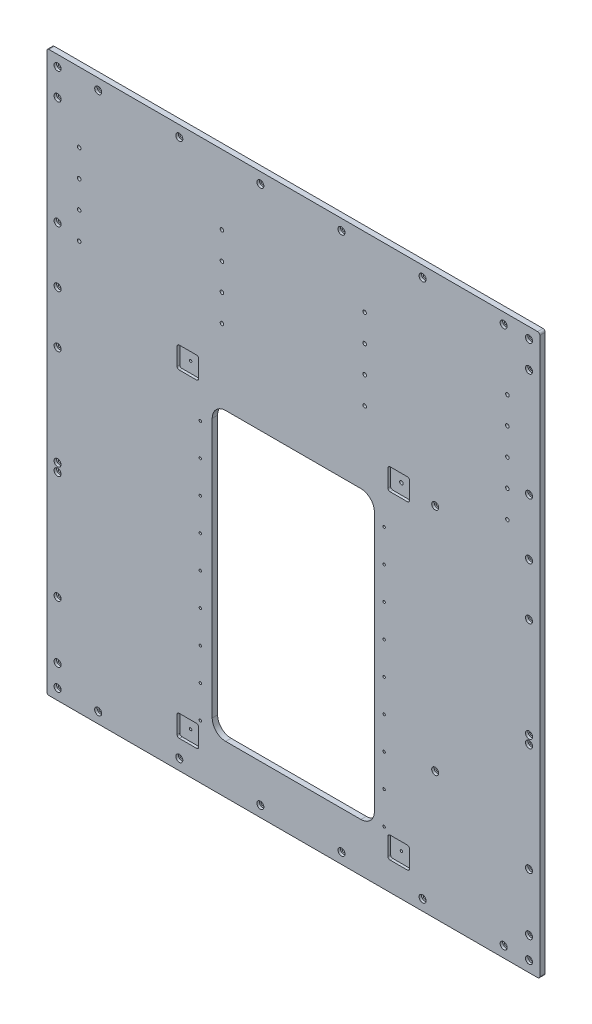
from build123d import *

# Parameters (mm, degrees)
BOSS_EXTRU_1_DEPTH                           = 10
ENL_V_MAT_EXTRU_1_DEPTH                      = 690.813199352
D_GAGEMENT_M41_D                             = 4.5
R_P_TITION_LIN_AIRE8_COUNT                   = 9
R_P_TITION_LIN_AIRE8_PITCH                   = 60
R_P_TITION_LIN_AIRE8_COUNT_DIR2              = 2
R_P_TITION_LIN_AIRE8_PITCH_DIR2              = 340
D_GAGEMENT_M65_D                             = 6.6
R_P_TITION_LIN_AIRE9_COUNT                   = 2
R_P_TITION_LIN_AIRE9_PITCH                   = 872
R_P_TITION_LIN_AIRE10_COUNT                  = 6
R_P_TITION_LIN_AIRE10_PITCH                  = 150
R_P_TITION_LIN_AIRE11_COUNT                  = 5
R_P_TITION_LIN_AIRE11_PITCH                  = 200
R_P_TITION_LIN_AIRE11_COUNT_DIR2             = 2
R_P_TITION_LIN_AIRE11_PITCH_DIR2             = 872
CHAMBRAGE_POUR_VIS_T_TE_RONDE_BOMB_4_A_COUNT = 2
CHAMBRAGE_POUR_VIS_T_TE_RONDE_BOMB_4_A_PITCH = 40
R_P_TITION_LIN_AIRE13_COUNT                  = 2
R_P_TITION_LIN_AIRE13_PITCH                  = 872
R_P_TITION_LIN_AIRE14_COUNT                  = 6
R_P_TITION_LIN_AIRE14_PITCH                  = 150
ESQUISSE41_R                                 = 1.5
ENL_V_MAT_EXTRU_2_DEPTH                      = 690.813199352
CHAMBRAGE_POUR_VIS_T_TE_RONDE_BOMB_6_A_COUNT = 2
CHAMBRAGE_POUR_VIS_T_TE_RONDE_BOMB_6_A_PITCH = 281
CHAMBRAGE_POUR_VIS_T_TE_RONDE_BOMB_7_COUNT   = 2
CHAMBRAGE_POUR_VIS_T_TE_RONDE_BOMB_7_PITCH   = 916.15773751
CHAMBRAGE_POUR_VIS_T_TE_RONDE_BOMB_8_COUNT   = 2
CHAMBRAGE_POUR_VIS_T_TE_RONDE_BOMB_8_PITCH   = 872
D_GAGEMENT_M67_D                             = 6.6
R_P_TITION_LIN_AIRE15_COUNT                  = 4
R_P_TITION_LIN_AIRE15_PITCH                  = 264
R_P_TITION_LIN_AIRE15_COUNT_DIR2             = 5
R_P_TITION_LIN_AIRE15_PITCH_DIR2             = 50
D_GAGEMENT_M68_D                             = 6.6
R_P_TITION_LIN_AIRE16_COUNT                  = 2
R_P_TITION_LIN_AIRE16_PITCH                  = 390
R_P_TITION_LIN_AIRE16_COUNT_DIR2             = 2
R_P_TITION_LIN_AIRE16_PITCH_DIR2             = 590
ENL_V_MAT_EXTRU_6_DEPTH                      = 5
R_P_TITION_LIN_AIRE18_COUNT                  = 2
R_P_TITION_LIN_AIRE18_PITCH                  = 590
R_P_TITION_LIN_AIRE18_COUNT_DIR2             = 2
R_P_TITION_LIN_AIRE18_PITCH_DIR2             = 390
ENL_V_MAT_EXTRU_9_DEPTH                      = 5
R_P_TITION_LIN_AIRE20_COUNT                  = 2
R_P_TITION_LIN_AIRE20_PITCH                  = 425
D_GAGEMENT_M610_D                            = 6.6
R_P_TITION_LIN_AIRE21_COUNT                  = 2
R_P_TITION_LIN_AIRE21_PITCH                  = 425


with BuildPart() as part:
    # Esquisse1 → Boss.-Extru.1 (new body)
    with BuildSketch(Plane.XY):
        with BuildLine():
            Line((-452, -517.5), (452, -517.5))
            ThreePointArc((452, -517.5), (454.828427125, -516.328427125), (456, -513.5))
            Line((456, -513.5), (456, 513.5))
            ThreePointArc((456, 513.5), (454.828427125, 516.328427125), (452, 517.5))
            Line((452, 517.5), (-452, 517.5))
            ThreePointArc((-452, 517.5), (-454.828427125, 516.328427125), (-456, 513.5))
            Line((-456, 513.5), (-456, -513.5))
            ThreePointArc((-456, -513.5), (-454.828427125, -516.328427125), (-452, -517.5))
        make_face()
    extrude(amount=BOSS_EXTRU_1_DEPTH)

    # Esquisse2 → Enlèv. mat.-Extru.1 (cut, through all)
    with BuildSketch(Plane.XY.offset(10)):
        with BuildLine():
            Line((-125, -427.5), (125, -427.5))
            ThreePointArc((125, -427.5), (142.67766953, -420.17766953), (150, -402.5))
            Line((150, -402.5), (150, 77.5))
            ThreePointArc((150, 77.5), (142.67766953, 95.17766953), (125, 102.5))
            Line((125, 102.5), (-125, 102.5))
            ThreePointArc((-125, 102.5), (-142.67766953, 95.17766953), (-150, 77.5))
            Line((-150, 77.5), (-150, -402.5))
            ThreePointArc((-150, -402.5), (-142.67766953, -420.17766953), (-125, -427.5))
        make_face()
    extrude(amount=-ENL_V_MAT_EXTRU_1_DEPTH, mode=Mode.SUBTRACT)

    # Dégagement M41 (through all)
    with Locations(Plane.XY.offset(10)):
        with Locations((-172, -417.5)):
            d_gagement_m41 = Hole(D_GAGEMENT_M41_D / 2)

    # Répétition linéaire8: D_gagement M41 9 × 2
    with Locations(*[(j * R_P_TITION_LIN_AIRE8_PITCH_DIR2, i * R_P_TITION_LIN_AIRE8_PITCH, 0) for i in range(R_P_TITION_LIN_AIRE8_COUNT) for j in range(R_P_TITION_LIN_AIRE8_COUNT_DIR2) if (i, j) != (0, 0)]):
        add(d_gagement_m41, mode=Mode.SUBTRACT)

    # Dégagement M65 (through all)
    with Locations(Plane(origin=(0, 0, 0), x_dir=(-1, 0, 0), z_dir=(0, 0, -1))):
        with Locations((-436.000000001, 497.5), (-436.000000001, 448.286376646), (-389.123182304, 497.5), (-436.000000001, -457.5), (-436.000000001, -497.5), (-389.123182304, -497.5), (435.999999999, -457.5), (435.999999999, -497.5)):
            Hole(D_GAGEMENT_M65_D / 2)

    # Esquisse27 → Chambrage pour vis _ t_te ronde bomb_e M (revolve, cut)
    with BuildSketch(Plane(origin=(436.000000001, 497.5, 10), x_dir=(0, -1, 0), z_dir=(1, 0, 0))):
        Polygon((0, 0), (0, 10), (3.3, 10), (3.3, 4.625), (3.325, 4.6), (6.5, 4.6), (6.5, 0), align=None)
    chambrage_pour_vis_t_te_ronde_bomb_e_m = revolve(axis=Axis((436.000000001, 497.5, 16.35), (0, 0, -1)), mode=Mode.SUBTRACT)

    # Répétition linéaire9: Chambrage pour vis _ t_te ronde bomb_e M ×2
    with Locations(*[(-i * R_P_TITION_LIN_AIRE9_PITCH, 0, 0) for i in range(1, R_P_TITION_LIN_AIRE9_COUNT)]):
        add(chambrage_pour_vis_t_te_ronde_bomb_e_m, mode=Mode.SUBTRACT)

    # Esquisse29 → Chambrage pour vis _ t_te ronde bomb 2 (revolve, cut)
    with BuildSketch(Plane(origin=(389.123182304, 497.5, 10), x_dir=(0, -1, 0), z_dir=(1, 0, 0))):
        Polygon((0, 0), (0, 10), (3.3, 10), (3.3, 4.625), (3.325, 4.6), (6.5, 4.6), (6.5, 0), align=None)
    chambrage_pour_vis_t_te_ronde_bomb_2 = revolve(axis=Axis((389.123182304, 497.5, 16.35), (0, 0, -1)), mode=Mode.SUBTRACT)

    # Répétition linéaire10: Chambrage pour vis _ t_te ronde bomb 2 ×6
    with Locations(*[(-i * R_P_TITION_LIN_AIRE10_PITCH, 0, 0) for i in range(1, R_P_TITION_LIN_AIRE10_COUNT)]):
        add(chambrage_pour_vis_t_te_ronde_bomb_2, mode=Mode.SUBTRACT)

    # Esquisse31 → Chambrage pour vis _ t_te ronde bomb 3 (revolve, cut)
    with BuildSketch(Plane(origin=(436.000000001, 448.286376646, 10), x_dir=(0, -1, 0), z_dir=(1, 0, 0))):
        Polygon((0, 0), (0, 10), (3.3, 10), (3.3, 4.625), (3.325, 4.6), (6.5, 4.6), (6.5, 0), align=None)
    chambrage_pour_vis_t_te_ronde_bomb_3 = revolve(axis=Axis((436.000000001, 448.286376646, 16.35), (0, 0, -1)), mode=Mode.SUBTRACT)

    # Répétition linéaire11: Chambrage pour vis _ t_te ronde bomb 3 5 × 2
    with Locations(*[(-j * R_P_TITION_LIN_AIRE11_PITCH_DIR2, -i * R_P_TITION_LIN_AIRE11_PITCH, 0) for i in range(R_P_TITION_LIN_AIRE11_COUNT) for j in range(R_P_TITION_LIN_AIRE11_COUNT_DIR2) if (i, j) != (0, 0)]):
        add(chambrage_pour_vis_t_te_ronde_bomb_3, mode=Mode.SUBTRACT)

    # Esquisse33 → Chambrage pour vis _ t_te ronde bomb 4 (revolve, cut)
    with BuildSketch(Plane(origin=(436.000000001, -457.5, 10), x_dir=(0, -1, 0), z_dir=(1, 0, 0))):
        Polygon((0, 0), (0, 10), (3.3, 10), (3.3, 4.625), (3.325, 4.6), (6.5, 4.6), (6.5, 0), align=None)
    chambrage_pour_vis_t_te_ronde_bomb_4 = revolve(axis=Axis((436.000000001, -457.5, 16.35), (0, 0, -1)), mode=Mode.SUBTRACT)

    # Chambrage pour vis _ t_te ronde bomb 4 a: Chambrage pour vis _ t_te ronde bomb 4 ×2
    with Locations(*[(0, -i * CHAMBRAGE_POUR_VIS_T_TE_RONDE_BOMB_4_A_PITCH, 0) for i in range(1, CHAMBRAGE_POUR_VIS_T_TE_RONDE_BOMB_4_A_COUNT)]):
        add(chambrage_pour_vis_t_te_ronde_bomb_4, mode=Mode.SUBTRACT)

    # Répétition linéaire13: Chambrage pour vis _ t_te ronde bomb 4 ×2
    with Locations(*[(-i * R_P_TITION_LIN_AIRE13_PITCH, 0, 0) for i in range(1, R_P_TITION_LIN_AIRE13_COUNT)]):
        add(chambrage_pour_vis_t_te_ronde_bomb_4, mode=Mode.SUBTRACT)

    # Répétition linéaire13 copy 1 sketch → Répétition linéaire13 copy 1 (revolve, cut)
    with BuildSketch(Plane(origin=(-435.999999999, -497.5, 10), x_dir=(0, -1, 0), z_dir=(1, 0, 0))):
        Polygon((0, 0), (0, 10), (3.3, 10), (3.3, 4.625), (3.325, 4.6), (6.5, 4.6), (6.5, 0), align=None)
    revolve(axis=Axis((-435.999999999, -497.5, 16.35), (0, 0, -1)), mode=Mode.SUBTRACT)

    # Esquisse35 → Chambrage pour vis _ t_te ronde bomb 5 (revolve, cut)
    with BuildSketch(Plane(origin=(389.123182304, -497.5, 10), x_dir=(0, -1, 0), z_dir=(1, 0, 0))):
        Polygon((0, 0), (0, 10), (3.3, 10), (3.3, 4.625), (3.325, 4.6), (6.5, 4.6), (6.5, 0), align=None)
    chambrage_pour_vis_t_te_ronde_bomb_5 = revolve(axis=Axis((389.123182304, -497.5, 16.35), (0, 0, -1)), mode=Mode.SUBTRACT)

    # Répétition linéaire14: Chambrage pour vis _ t_te ronde bomb 5 ×6
    with Locations(*[(-i * R_P_TITION_LIN_AIRE14_PITCH, 0, 0) for i in range(1, R_P_TITION_LIN_AIRE14_COUNT)]):
        add(chambrage_pour_vis_t_te_ronde_bomb_5, mode=Mode.SUBTRACT)

    # Esquisse41 → Enlèv. mat.-Extru.2 (cut, through all)
    with BuildSketch(Plane.XY.offset(10)):
        with Locations((-436, 144.5)):
            Circle(ESQUISSE41_R)
        with Locations((-436, -136.5)):
            Circle(ESQUISSE41_R)
    enl_v_mat_extru_2 = extrude(amount=-ENL_V_MAT_EXTRU_2_DEPTH, mode=Mode.SUBTRACT)

    # Symétrie1: Enlèv. mat.-Extru.2 across plane
    add(enl_v_mat_extru_2.mirror(Plane(origin=(0, 0, 0), x_dir=(0, 0, 1), z_dir=(1, 0, 0))), mode=Mode.SUBTRACT)

    # Esquisse44 → Chambrage pour vis _ t_te ronde bomb 6 (revolve, cut)
    with BuildSketch(Plane(origin=(-436, 144.5, 10), x_dir=(0, -1, 0), z_dir=(1, 0, 0))):
        Polygon((0, 0), (0, 10), (3.3, 10), (3.3, 4.625), (3.325, 4.6), (6.5, 4.6), (6.5, 0), align=None)
    chambrage_pour_vis_t_te_ronde_bomb_6 = revolve(axis=Axis((-436, 144.5, 16.35), (0, 0, -1)), mode=Mode.SUBTRACT)

    # Chambrage pour vis _ t_te ronde bomb 6 a: Chambrage pour vis _ t_te ronde bomb 6 ×2
    with Locations(*[(0, -i * CHAMBRAGE_POUR_VIS_T_TE_RONDE_BOMB_6_A_PITCH, 0) for i in range(1, CHAMBRAGE_POUR_VIS_T_TE_RONDE_BOMB_6_A_COUNT)]):
        add(chambrage_pour_vis_t_te_ronde_bomb_6, mode=Mode.SUBTRACT)

    # Chambrage pour vis _ t_te ronde bomb 7: Chambrage pour vis _ t_te ronde bomb 6 ×2
    with Locations(*[Vector(0.9518011629413234, -0.306715741727653, 0) * (i * CHAMBRAGE_POUR_VIS_T_TE_RONDE_BOMB_7_PITCH) for i in range(1, CHAMBRAGE_POUR_VIS_T_TE_RONDE_BOMB_7_COUNT)]):
        add(chambrage_pour_vis_t_te_ronde_bomb_6, mode=Mode.SUBTRACT)

    # Chambrage pour vis _ t_te ronde bomb 8: Chambrage pour vis _ t_te ronde bomb 6 ×2
    with Locations(*[(i * CHAMBRAGE_POUR_VIS_T_TE_RONDE_BOMB_8_PITCH, 0, 0) for i in range(1, CHAMBRAGE_POUR_VIS_T_TE_RONDE_BOMB_8_COUNT)]):
        add(chambrage_pour_vis_t_te_ronde_bomb_6, mode=Mode.SUBTRACT)

    # Dégagement M67 (through all)
    with Locations(Plane(origin=(0, 0, 0), x_dir=(-1, 0, 0), z_dir=(0, 0, -1))):
        with Locations((-396.00143494, 188.397832099)):
            d_gagement_m67 = Hole(D_GAGEMENT_M67_D / 2)

    # Répétition linéaire15: D_gagement M67 4 × 5, 3 skipped
    with Locations(*[(-i * R_P_TITION_LIN_AIRE15_PITCH, j * R_P_TITION_LIN_AIRE15_PITCH_DIR2, 0) for i in range(R_P_TITION_LIN_AIRE15_COUNT) for j in range(R_P_TITION_LIN_AIRE15_COUNT_DIR2) if (i, j) not in ((0, 0), (1, 0), (2, 0), (3, 0))]):
        add(d_gagement_m67, mode=Mode.SUBTRACT)

    # Dégagement M68 (through all)
    with Locations(Plane(origin=(0, 0, 0), x_dir=(-1, 0, 0), z_dir=(0, 0, -1))):
        with Locations((-195, 144.5)):
            Hole(D_GAGEMENT_M68_D / 2)

    # Esquisse49 → Chambrage pour vis _ t_te ronde bomb 9 (revolve, cut)
    with BuildSketch(Plane(origin=(195, 144.5, 10), x_dir=(0, -1, 0), z_dir=(1, 0, 0))):
        Polygon((0, 0), (0, 10), (2.25, 10), (2.25, 3.125), (2.275, 3.1), (4.5, 3.1), (4.5, 0), align=None)
    chambrage_pour_vis_t_te_ronde_bomb_9 = revolve(axis=Axis((195, 144.5, 16.35), (0, 0, -1)), mode=Mode.SUBTRACT)

    # Répétition linéaire16: Chambrage pour vis _ t_te ronde bomb 9 2 × 2
    with Locations(*[(-i * R_P_TITION_LIN_AIRE16_PITCH, -j * R_P_TITION_LIN_AIRE16_PITCH_DIR2, 0) for i in range(R_P_TITION_LIN_AIRE16_COUNT) for j in range(R_P_TITION_LIN_AIRE16_COUNT_DIR2) if (i, j) != (0, 0)]):
        add(chambrage_pour_vis_t_te_ronde_bomb_9, mode=Mode.SUBTRACT)

    # Esquisse52 → Enlèv. mat.-Extru.6 (cut)
    with BuildSketch(Plane(origin=(0, 0, 10), x_dir=(-1, 0, 0), z_dir=(0, 0, -1))):
        with BuildLine():
            Line((-211, -425.5), (-179, -425.5))
            add(Edge.make_bspline(
                [(-179, -425.5), (-175.343145751, -425.843145751), (-175, -429.5)],
                knots=[0, 0, 0, 1, 1, 1], degree=2))
            Line((-175, -429.5), (-175, -461.5))
            add(Edge.make_bspline(
                [(-175, -461.5), (-175.343145751, -465.156854249), (-179, -465.5)],
                knots=[0, 0, 0, 1, 1, 1], degree=2))
            Line((-179, -465.5), (-211, -465.5))
            add(Edge.make_bspline(
                [(-211, -465.5), (-214.656854249, -465.156854249), (-215, -461.5)],
                knots=[0, 0, 0, 1, 1, 1], degree=2))
            Line((-215, -461.5), (-215, -429.5))
            add(Edge.make_bspline(
                [(-215, -429.5), (-214.656854249, -425.843145751), (-211, -425.5)],
                knots=[0, 0, 0, 1, 1, 1], degree=2))
        make_face()
    enl_v_mat_extru_6 = extrude(amount=ENL_V_MAT_EXTRU_6_DEPTH, mode=Mode.SUBTRACT)

    # Répétition linéaire18: Enl_v. mat.-Extru.6 2 × 2
    with Locations(*[(-j * R_P_TITION_LIN_AIRE18_PITCH_DIR2, i * R_P_TITION_LIN_AIRE18_PITCH, 0) for i in range(R_P_TITION_LIN_AIRE18_COUNT) for j in range(R_P_TITION_LIN_AIRE18_COUNT_DIR2) if (i, j) != (0, 0)]):
        add(enl_v_mat_extru_6, mode=Mode.SUBTRACT)

    # Esquisse51 → Enlèv. mat.-Extru.9 (cut)
    with BuildSketch(Plane.XY):
        with BuildLine():
            Line((246.576088012, 163.539500972), (278.576088012, 163.539500972))
            add(Edge.make_bspline(
                [(278.576088012, 163.539500972), (282.232942261, 163.196355221), (282.576088012, 159.539500972)],
                knots=[0, 0, 0, 1, 1, 1], degree=2))
            add(Edge.make_bspline(
                [(282.576088012, 159.539500972), (282.576088012, 144.511124743), (282.576088012, 127.539500972)],
                knots=[0, 0, 0, 1, 1, 1], degree=2))
            add(Edge.make_bspline(
                [(282.576088012, 127.539500972), (282.232942261, 123.882646722), (278.576088012, 123.539500972)],
                knots=[0, 0, 0, 1, 1, 1], degree=2))
            Line((278.576088012, 123.539500972), (246.576088012, 123.539500972))
            add(Edge.make_bspline(
                [(246.576088012, 123.539500972), (242.919233762, 123.882646722), (242.576088012, 127.539500972)],
                knots=[0, 0, 0, 1, 1, 1], degree=2))
            Line((242.576088012, 127.539500972), (242.576088012, 159.539500972))
            add(Edge.make_bspline(
                [(242.576088012, 159.539500972), (242.919233762, 163.196355221), (246.576088012, 163.539500972)],
                knots=[0, 0, 0, 1, 1, 1], degree=2))
        make_face()
    enl_v_mat_extru_9 = extrude(amount=ENL_V_MAT_EXTRU_9_DEPTH, mode=Mode.SUBTRACT)

    # Répétition linéaire20: Enlèv. mat.-Extru.9 ×2
    with Locations(*[(0, -i * R_P_TITION_LIN_AIRE20_PITCH, 0) for i in range(1, R_P_TITION_LIN_AIRE20_COUNT)]):
        add(enl_v_mat_extru_9, mode=Mode.SUBTRACT)

    # Dégagement M610 (through all)
    with Locations(Plane(origin=(0, 0, 0), x_dir=(-1, 0, 0), z_dir=(0, 0, -1))):
        with Locations((-262.5, 143.5)):
            Hole(D_GAGEMENT_M610_D / 2)

    # Esquisse57 → Chambrage pour vis _ t_te ronde bomb 10 (revolve, cut)
    with BuildSketch(Plane(origin=(262.5, 143.5, 10), x_dir=(0, -1, 0), z_dir=(1, 0, 0))):
        Polygon((0, 0), (0, 10), (3.3, 10), (3.3, 4.625), (3.325, 4.6), (6.5, 4.6), (6.5, 0), align=None)
    chambrage_pour_vis_t_te_ronde_bomb_10 = revolve(axis=Axis((262.5, 143.5, 16.35), (0, 0, -1)), mode=Mode.SUBTRACT)

    # Répétition linéaire21: Chambrage pour vis _ t_te ronde bomb 10 ×2
    with Locations(*[(0, -i * R_P_TITION_LIN_AIRE21_PITCH, 0) for i in range(1, R_P_TITION_LIN_AIRE21_COUNT)]):
        add(chambrage_pour_vis_t_te_ronde_bomb_10, mode=Mode.SUBTRACT)


solid = part.part
